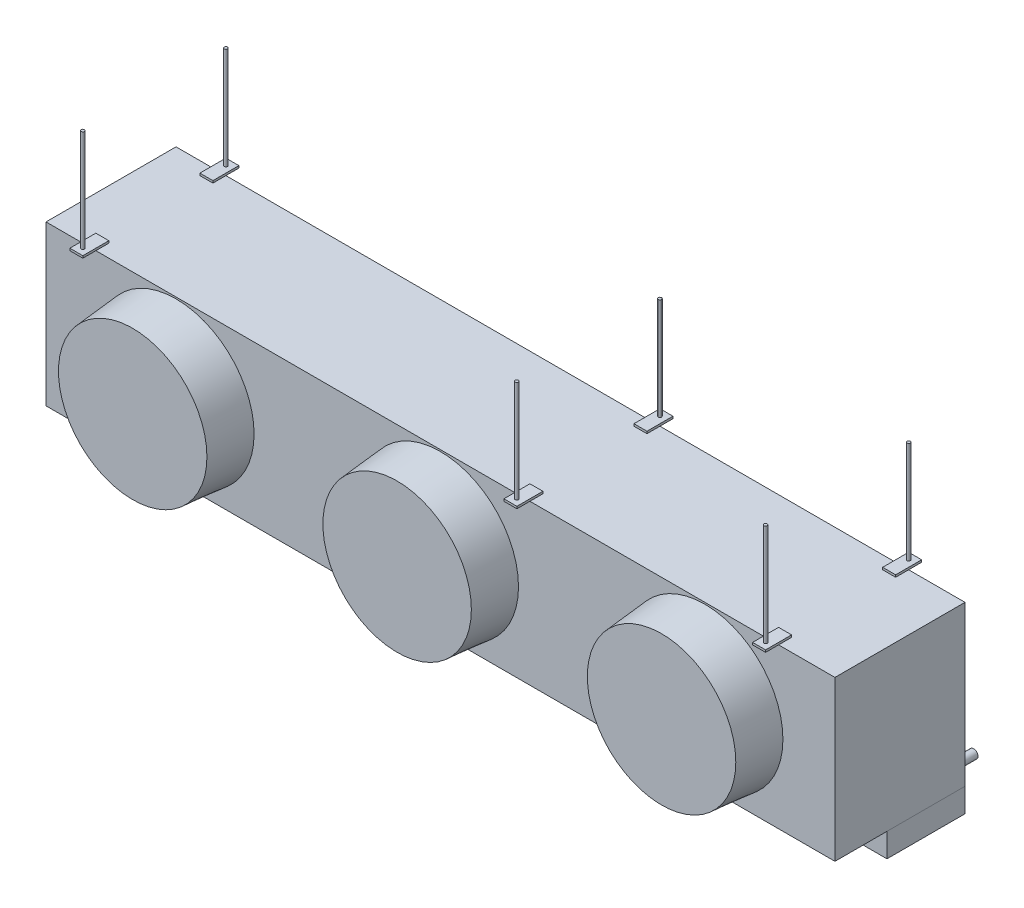
from build123d import *

# Parameters (mm, degrees)
SKETCH1_W                     = 2311.4
SKETCH1_H                     = 381
BOSS_EXTRUDE1_DEPTH           = 466.725
SKETCH2_R                     = 228.6
BOSS_EXTRUDE2_DEPTH           = 127
BOSS_EXTRUDE2_DRAFT           = 5
BOSS_EXTRUDE2_PROFILE_2_DEPTH = 127
BOSS_EXTRUDE2_PROFILE_2_DRAFT = 5
BOSS_EXTRUDE2_PROFILE_3_DEPTH = 127
BOSS_EXTRUDE2_PROFILE_3_DRAFT = 5
SKETCH3_W                     = 38.1
SKETCH3_H                     = 76.2
SKETCH3_R                     = 4.7625
BOSS_EXTRUDE3_DEPTH           = 6.35
SKETCH4_R                     = 4.7625
BOSS_EXTRUDE4_DEPTH           = 304.8
BOSS_EXTRUDE4_2_DEPTH         = 304.8
BOSS_EXTRUDE4_3_DEPTH         = 304.8
BOSS_EXTRUDE4_4_DEPTH         = 304.8
BOSS_EXTRUDE4_5_DEPTH         = 304.8
BOSS_EXTRUDE4_6_DEPTH         = 304.8
SKETCH5_W                     = 2311.4
SKETCH5_H                     = 228.6
BOSS_EXTRUDE5_DEPTH           = 69.85
SKETCH6_R                     = 12.7
SKETCH6_R_2                   = 11.1125
BOSS_EXTRUDE6_DEPTH           = 44.45
SKETCH7_R                     = 12.7
BOSS_EXTRUDE7_DEPTH           = 76.2


with BuildPart() as part:
    # Sketch1 → Boss-Extrude1 (new body)
    with BuildSketch(Plane(origin=(0, 0, 0), x_dir=(1, 0, 0), z_dir=(0, 1, 0))):
        Rectangle(SKETCH1_W, SKETCH1_H)
    extrude(amount=BOSS_EXTRUDE1_DEPTH)


with BuildPart() as boss_extrude2_tool:
    # Sketch2 → Boss-Extrude2 (with draft: the straight prism first)
    with BuildSketch(Plane.XY.offset(190.5)):
        with Locations((0, 233.3625)):
            Circle(SKETCH2_R)
    extrude(amount=BOSS_EXTRUDE2_DEPTH)
    # Boss-Extrude2: the draft: its side faces are tilted about the plane it starts from
    boss_extrude2_sides = [boss_extrude2_tool.faces().sort_by_distance(p)[0] for p in [
        (-228.6, 233.3625, 254),
    ]]
    draft(boss_extrude2_sides, Plane.XY.offset(190.5), BOSS_EXTRUDE2_DRAFT)


with BuildPart() as part_1:
    add(part.part)

    # Boss-Extrude2: add boss_extrude2_tool
    add(boss_extrude2_tool.part)


with BuildPart() as boss_extrude2_profile_2_tool:
    # Sketch2 → Boss-Extrude2 profile 2 (with draft: the straight prism first)
    with BuildSketch(Plane.XY.offset(190.5)):
        with Locations((774.7, 233.3625)):
            Circle(SKETCH2_R)
    extrude(amount=BOSS_EXTRUDE2_PROFILE_2_DEPTH)
    # Boss-Extrude2 profile 2: the draft: its side faces are tilted about the plane it starts from
    boss_extrude2_profile_2_sides = [boss_extrude2_profile_2_tool.faces().sort_by_distance(p)[0] for p in [
        (546.1, 233.3625, 254),
    ]]
    draft(boss_extrude2_profile_2_sides, Plane.XY.offset(190.5), BOSS_EXTRUDE2_PROFILE_2_DRAFT)


with BuildPart() as part_2:
    add(part_1.part)

    # Boss-Extrude2 profile 2: add boss_extrude2_profile_2_tool
    add(boss_extrude2_profile_2_tool.part)


with BuildPart() as boss_extrude2_profile_3_tool:
    # Sketch2 → Boss-Extrude2 profile 3 (with draft: the straight prism first)
    with BuildSketch(Plane.XY.offset(190.5)):
        with Locations((-774.7, 233.3625)):
            Circle(SKETCH2_R)
    extrude(amount=BOSS_EXTRUDE2_PROFILE_3_DEPTH)
    # Boss-Extrude2 profile 3: the draft: its side faces are tilted about the plane it starts from
    boss_extrude2_profile_3_sides = [boss_extrude2_profile_3_tool.faces().sort_by_distance(p)[0] for p in [
        (-1003.3, 233.3625, 254),
    ]]
    draft(boss_extrude2_profile_3_sides, Plane.XY.offset(190.5), BOSS_EXTRUDE2_PROFILE_3_DRAFT)


with BuildPart() as part_3:
    add(part_2.part)

    # Boss-Extrude2 profile 3: add boss_extrude2_profile_3_tool
    add(boss_extrude2_profile_3_tool.part)

    # Sketch3 → Boss-Extrude3 (add)
    # profile 1 of 6: a face of its own
    with BuildSketch(Plane(origin=(0, 466.725, 0), x_dir=(1, 0, 0), z_dir=(0, 1, 0))):
        with Locations((242.9637, 190.5)):
            Rectangle(SKETCH3_W, SKETCH3_H)
        with Locations((242.9637, 209.55)):
            Circle(SKETCH3_R, mode=Mode.SUBTRACT)
    # profile 2 of 6: a face of its own
    with BuildSketch(Plane(origin=(0, 466.725, 0), x_dir=(1, 0, 0), z_dir=(0, 1, 0))):
        with Locations((242.9637, -190.5)):
            Rectangle(SKETCH3_W, SKETCH3_H)
        with Locations((242.9637, -209.55)):
            Circle(SKETCH3_R, mode=Mode.SUBTRACT)
    # profile 3 of 6: a face of its own
    with BuildSketch(Plane(origin=(0, 466.725, 0), x_dir=(1, 0, 0), z_dir=(0, 1, 0))):
        with Locations((971.55, 190.5)):
            Rectangle(SKETCH3_W, SKETCH3_H)
        with Locations((971.55, 209.55)):
            Circle(SKETCH3_R, mode=Mode.SUBTRACT)
    # profile 4 of 6: a face of its own
    with BuildSketch(Plane(origin=(0, 466.725, 0), x_dir=(1, 0, 0), z_dir=(0, 1, 0))):
        with Locations((971.55, -190.5)):
            Rectangle(SKETCH3_W, SKETCH3_H)
        with Locations((971.55, -209.55)):
            Circle(SKETCH3_R, mode=Mode.SUBTRACT)
    # profile 5 of 6: a face of its own
    with BuildSketch(Plane(origin=(0, 466.725, 0), x_dir=(1, 0, 0), z_dir=(0, 1, 0))):
        with Locations((-1028.7, 190.5)):
            Rectangle(SKETCH3_W, SKETCH3_H)
        with Locations((-1028.7, 209.55)):
            Circle(SKETCH3_R, mode=Mode.SUBTRACT)
    # profile 6 of 6: a face of its own
    with BuildSketch(Plane(origin=(0, 466.725, 0), x_dir=(1, 0, 0), z_dir=(0, 1, 0))):
        with Locations((-1028.7, -190.5)):
            Rectangle(SKETCH3_W, SKETCH3_H)
        with Locations((-1028.7, -209.55)):
            Circle(SKETCH3_R, mode=Mode.SUBTRACT)
    extrude(amount=BOSS_EXTRUDE3_DEPTH)

    # Sketch7 → Boss-Extrude7 (add)
    with BuildSketch(Plane(origin=(0, 0, -190.5), x_dir=(-1, 0, 0), z_dir=(0, 0, -1))):
        with Locations((-1104.9, 19.05)):
            Circle(SKETCH7_R)
        with Locations((1104.9, 19.05)):
            Circle(SKETCH7_R)
    extrude(amount=BOSS_EXTRUDE7_DEPTH)


with BuildPart() as body_2:
    # Sketch4 → Boss-Extrude4 (new body)
    with BuildSketch(Plane(origin=(0, 466.725, 0), x_dir=(1, 0, 0), z_dir=(0, 1, 0))):
        with Locations((-1028.7, 209.55)):
            Circle(SKETCH4_R)
    extrude(amount=BOSS_EXTRUDE4_DEPTH)


with BuildPart() as body_3:
    # Sketch4 → Boss-Extrude4 2 (new body)
    with BuildSketch(Plane(origin=(0, 466.725, 0), x_dir=(1, 0, 0), z_dir=(0, 1, 0))):
        with Locations((-1028.7, -209.55)):
            Circle(SKETCH4_R)
    extrude(amount=BOSS_EXTRUDE4_2_DEPTH)


with BuildPart() as body_4:
    # Sketch4 → Boss-Extrude4 3 (new body)
    with BuildSketch(Plane(origin=(0, 466.725, 0), x_dir=(1, 0, 0), z_dir=(0, 1, 0))):
        with Locations((242.9637, -209.55)):
            Circle(SKETCH4_R)
    extrude(amount=BOSS_EXTRUDE4_3_DEPTH)


with BuildPart() as body_5:
    # Sketch4 → Boss-Extrude4 4 (new body)
    with BuildSketch(Plane(origin=(0, 466.725, 0), x_dir=(1, 0, 0), z_dir=(0, 1, 0))):
        with Locations((242.9637, 209.55)):
            Circle(SKETCH4_R)
    extrude(amount=BOSS_EXTRUDE4_4_DEPTH)


with BuildPart() as body_6:
    # Sketch4 → Boss-Extrude4 5 (new body)
    with BuildSketch(Plane(origin=(0, 466.725, 0), x_dir=(1, 0, 0), z_dir=(0, 1, 0))):
        with Locations((971.55, 209.55)):
            Circle(SKETCH4_R)
    extrude(amount=BOSS_EXTRUDE4_5_DEPTH)


with BuildPart() as body_7:
    # Sketch4 → Boss-Extrude4 6 (new body)
    with BuildSketch(Plane(origin=(0, 466.725, 0), x_dir=(1, 0, 0), z_dir=(0, 1, 0))):
        with Locations((971.55, -209.55)):
            Circle(SKETCH4_R)
    extrude(amount=BOSS_EXTRUDE4_6_DEPTH)


with BuildPart() as body_8:
    # Sketch5 → Boss-Extrude5 (new body)
    with BuildSketch(Plane.XZ):
        with Locations((0, -76.2)):
            Rectangle(SKETCH5_W, SKETCH5_H)
    extrude(amount=BOSS_EXTRUDE5_DEPTH)

    # Sketch6 → Boss-Extrude6 (add)
    with BuildSketch(Plane.XZ.offset(69.85)):
        with Locations((0, -76.2)):
            Circle(SKETCH6_R)
        with Locations((0, -76.2)):
            Circle(SKETCH6_R_2, mode=Mode.SUBTRACT)
    extrude(amount=BOSS_EXTRUDE6_DEPTH)


solid = Compound([part_3.part, body_2.part, body_3.part, body_4.part, body_5.part, body_6.part, body_7.part, body_8.part])
